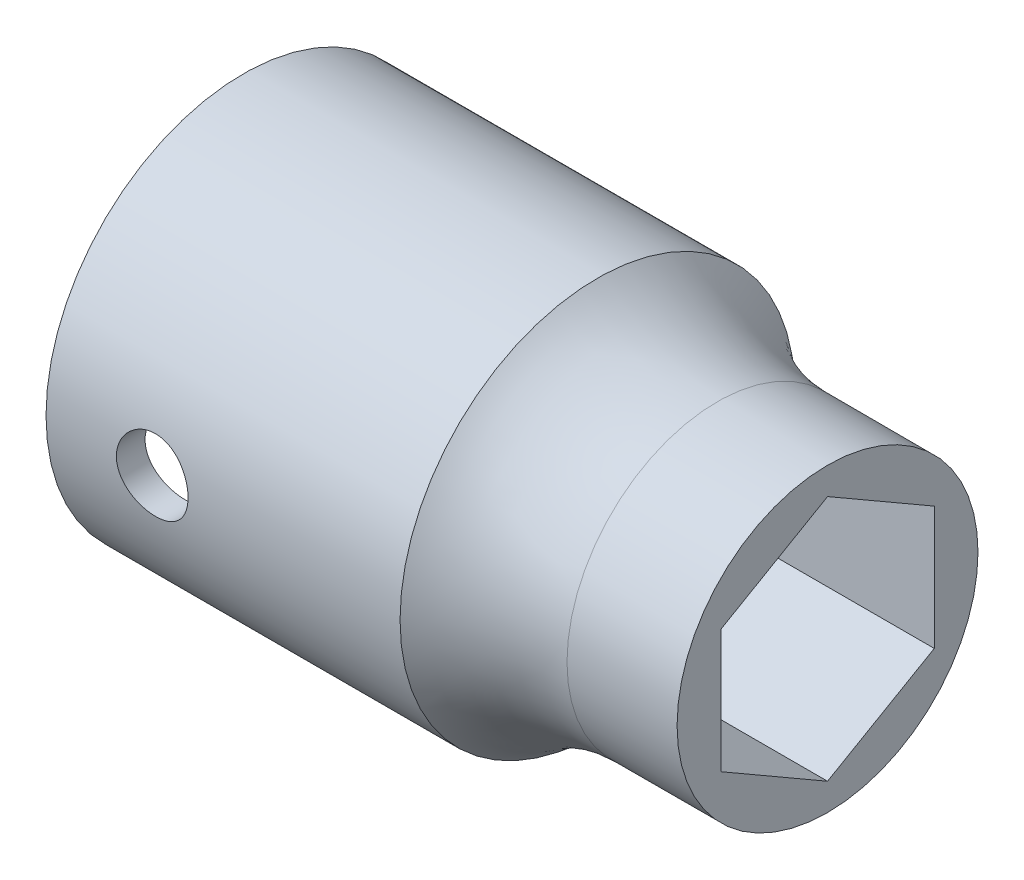
from build123d import *

# Parameters (mm, degrees)
CROQUIS1_R                 = 8.5
SALIENTE_EXTRUIR1_DEPTH    = 30
CORTAR_EXTRUIR1_DEPTH      = 8.5
CROQUIS9_R                 = 11.15
SALIENTE_EXTRUIR5_DEPTH    = 20
CROQUIS3_R                 = 9.53
CORTAR_EXTRUIR2_DEPTH      = 19
CORTAR_EXTRUIR3_REACH      = 26.691
CROQUIS4_R                 = 2.035
CORTAR_EXTRUIR4_DEPTH      = 34.891665642
CORTAR_EXTRUIR4_DEPTH_BACK = 34.891665642
CROQUIS5_R                 = 2.025
CROQUIS7_R                 = 8.5
SALIENTE_EXTRUIR3_DEPTH    = 3
REDONDEO1_R                = 10


with BuildPart() as part:
    # Croquis1 → Saliente-Extruir1 (new body)
    with BuildSketch(Plane(origin=(0, 0, 0), x_dir=(0, 0, -1), z_dir=(1, 0, 0))):
        Circle(CROQUIS1_R)
    extrude(amount=SALIENTE_EXTRUIR1_DEPTH)

    # Croquis2 → Cortar-Extruir1 (cut)
    with BuildSketch(Plane(origin=(30, 0, 0), x_dir=(0, 0, -1), z_dir=(1, 0, 0))):
        Polygon((0, -6.962844246), (6.03, -3.481422123), (6.03, 3.481422123), (0, 6.962844246), (-6.03, 3.481422123), (-6.03, -3.481422123), align=None)
    extrude(amount=-CORTAR_EXTRUIR1_DEPTH, mode=Mode.SUBTRACT)

    # Croquis9 → Saliente-Extruir5 (add)
    with BuildSketch(Plane.ZY):
        Circle(CROQUIS9_R)
    extrude(amount=-SALIENTE_EXTRUIR5_DEPTH)

    # Croquis3 → Cortar-Extruir2 (cut)
    with BuildSketch(Plane.ZY):
        Circle(CROQUIS3_R)
    extrude(amount=-CORTAR_EXTRUIR2_DEPTH, mode=Mode.SUBTRACT)

    # Croquis4 → Cortar-Extruir3 (cut, up to next)
    with BuildSketch(Plane.ZY.offset(-19), mode=Mode.PRIVATE) as cortar_extruir3_sk1:
        Circle(CROQUIS4_R)
    cortar_extruir3_tool1 = extrude(cortar_extruir3_sk1.sketch, amount=-CORTAR_EXTRUIR3_REACH, mode=Mode.PRIVATE) & part.part
    add(cortar_extruir3_tool1.solids().sort_by_distance((19, 0, 0))[0], mode=Mode.SUBTRACT)

    # Croquis5 → Cortar-Extruir4 (cut, two sides: drawn at the far end of the back side and taken through both)
    with BuildSketch(Plane.XY.offset(-CORTAR_EXTRUIR4_DEPTH_BACK)):
        with Locations((6, 0)):
            Circle(CROQUIS5_R)
    extrude(amount=CORTAR_EXTRUIR4_DEPTH + CORTAR_EXTRUIR4_DEPTH_BACK, mode=Mode.SUBTRACT)

    # Croquis7 → Saliente-Extruir3 (add)
    with BuildSketch(Plane(origin=(30, 0, 0), x_dir=(0, 0, -1), z_dir=(1, 0, 0))):
        with Locations(Location((0, 0, 0), (0, 0, 180))):
            Circle(CROQUIS7_R)
        Polygon((-6.03, -3.481422123), (0, -6.962844246), (6.03, -3.481422123), (6.03, 3.481422123), (0, 6.962844246), (-6.03, 3.481422123), align=None, mode=Mode.SUBTRACT)
    extrude(amount=SALIENTE_EXTRUIR3_DEPTH)

    # Redondeo1
    # the kernel refuses this fillet: 10 mm, written as the material it adds along each edge
    with BuildSketch(Plane(origin=(20, 0, 0), x_dir=(0, 0, -1), z_dir=(0, 1, 0))) as redondeo1_piece_1:
        with BuildLine():
            CenterArc((18.5, -6.780671058), REDONDEO1_R, 137.307216105, 42.692783895)
            Line((11.15, 0), (11.003, 0.135613421))
            ThreePointArc((11.003, 0.135613421), (9.825, 0.2), (8.5, 0.2))
            Line((8.5, 0.2), (8.3, 0))
            Line((8.3, 0), (8.3, -6.780671058))
            Line((8.3, -6.780671058), (8.5, -6.780671058))
        make_face()
    revolve(axis=Axis((20, 0, 0), (-1, 0, 0)))


solid = part.part
